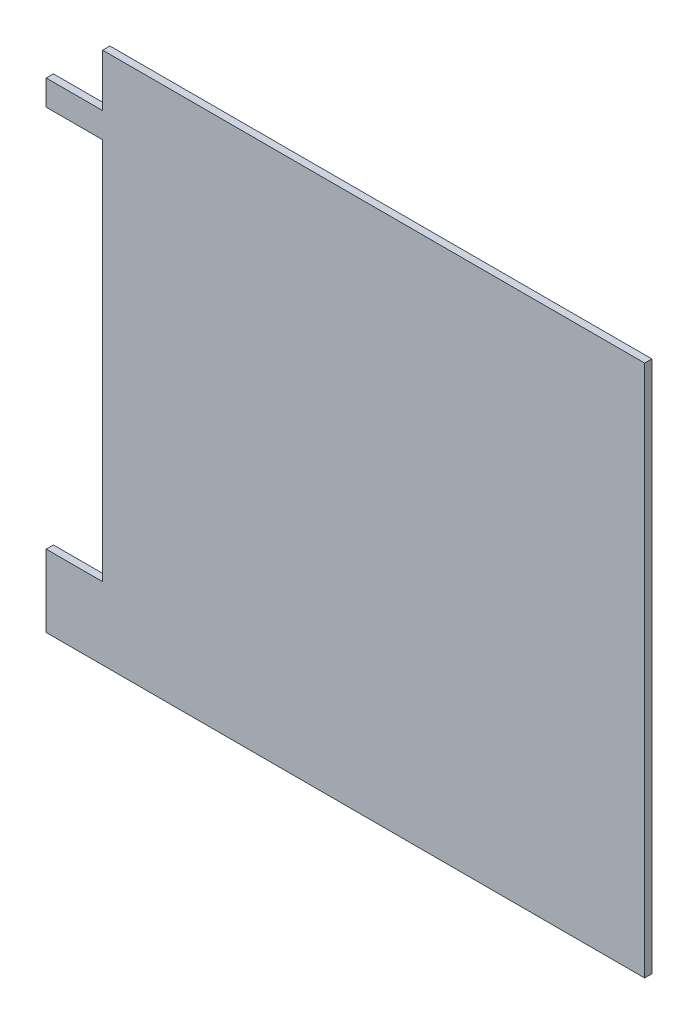
from build123d import *

# Parameters (mm, degrees)
BOSS_EXTRUDE1_DEPTH = 4


with BuildPart() as part:
    # Sketch1 → Boss-Extrude1 (new body)
    with BuildSketch(Plane.XY):
        Polygon((-5.82455923, 1), (-5.82455923, -13), (25.5, -13), (25.5, -225), (-5.82455923, -225), (-5.82455923, -265), (325.705856033, -265), (325.705856033, 30), (25.5, 30), (25.5, 1), align=None)
    extrude(amount=BOSS_EXTRUDE1_DEPTH)


solid = part.part
